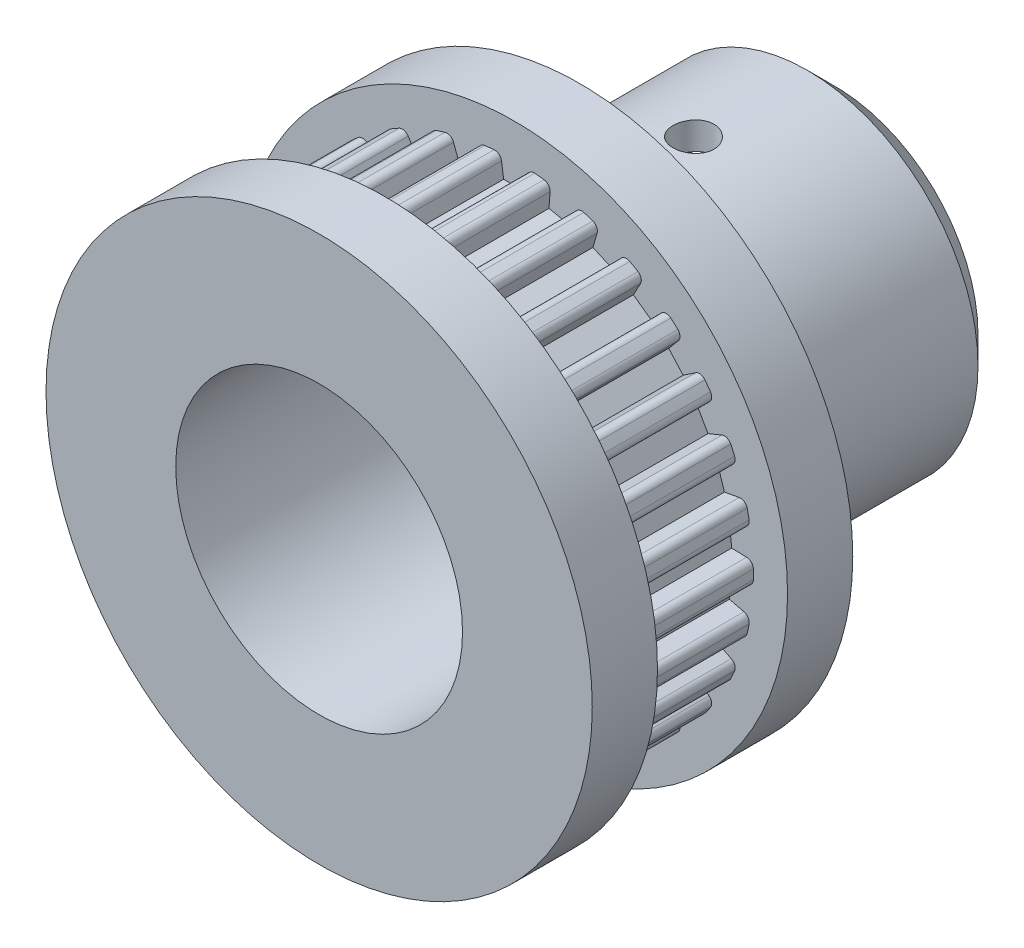
from build123d import *

# Parameters (mm, degrees)
SKETCH3_R                = 17.5
BOSS_EXTRUDE1_DEPTH      = 9.525
CUT_EXTRUDE1_DEPTH       = 9.525
FILLET1_R                = 0.508
FILLET2_R                = 0.508
SKETCH5_R                = 20
BOSS_EXTRUDE2_DEPTH      = 4.7752
CIRPATTERN1_COUNT        = 30
FILLET1_OF_CIRPATTERN1_R = 0.508
FILLET2_OF_CIRPATTERN1_R = 0.508
BOSS_EXTRUDE3_START      = 4.7752
SKETCH7_R                = 20
BOSS_EXTRUDE3_DEPTH      = 4.7752
SKETCH8_R                = 12.5
BOSS_EXTRUDE5_DEPTH      = 19.05
SKETCH12_R               = 10.5
CUT_EXTRUDE3_DEPTH       = 48.471529627
CHAMFER1_SIZE            = 2.38
CUT_EXTRUDE4_DEPTH       = 37.737955891
CUT_EXTRUDE4_DEPTH_BACK  = 1.27
SKETCH13_R               = 1.5


with BuildPart() as part:
    # Sketch3 → Boss-Extrude1 (new body)
    with BuildSketch(Plane.XY):
        with Locations(Location((0, 0, 0), (0, 0, 180))):
            Circle(SKETCH3_R)
    extrude(amount=BOSS_EXTRUDE1_DEPTH)

    # Sketch4 → Cut-Extrude1 (cut)
    with BuildSketch(Plane(origin=(0, 0, 0), x_dir=(-1, 0, 0), z_dir=(0, 0, -1))):
        Polygon((-1.5875, 21.740276586), (1.5875, 21.740276586), (0.79375, 15.9125), (-0.79375, 15.9125), align=None)
    cut_extrude1 = extrude(amount=-CUT_EXTRUDE1_DEPTH, mode=Mode.SUBTRACT)

    # Fillet1
    fillet1_edges = [part.edges().sort_by_distance(p)[0] for p in [
        (1.006027585, 17.471059169, 4.7625),
    ]]
    fillet(fillet1_edges, radius=FILLET1_R)

    # Fillet2
    fillet2_edges = [part.edges().sort_by_distance(p)[0] for p in [
        (-1.006027585, 17.471059169, 4.7625),
    ]]
    fillet(fillet2_edges, radius=FILLET2_R)

    # Sketch5 → Boss-Extrude2 (add)
    with BuildSketch(Plane.XY.offset(9.525)):
        Circle(SKETCH5_R)
    extrude(amount=BOSS_EXTRUDE2_DEPTH)

    # CirPattern1: Cut-Extrude1 ×30 about axis
    cirpattern1_axis = Axis((0, 0, 0), (0, 0, 1))
    for i in range(1, CIRPATTERN1_COUNT):
        add(cut_extrude1.rotate(cirpattern1_axis, i * 360 / CIRPATTERN1_COUNT), mode=Mode.SUBTRACT)

    # Fillet1 of CirPattern1
    fillet1_of_cirpattern1_edges = [part.edges().sort_by_distance(p)[0] for p in [
        (-2.648393984, 17.298439505, 4.7625),
        (-6.187068027, 16.369795027, 4.7625),
        (-9.455337508, 14.725711956, 4.7625),
        (-12.310363369, 12.43804461, 4.7625),
        (-14.627367279, 9.60677503, 4.7625),
        (-16.305085049, 6.355643284, 4.7625),
        (-17.270192362, 2.826739427, 4.7625),
        (-17.480509397, -0.825706506, 4.7625),
        (-16.92684429, -4.442065103, 4.7625),
        (-15.633394864, -7.864284139, 4.7625),
        (-13.656691065, -10.942796221, 4.7625),
        (-11.083124335, -13.5430556, 4.7625),
        (-8.025171888, -15.551418461, 4.7625),
        (-4.616480921, -16.880109713, 4.7625),
        (-1.006027585, -17.471059169, 4.7625),
        (2.648393984, -17.298439505, 4.7625),
        (6.187068027, -16.369795027, 4.7625),
        (9.455337508, -14.725711956, 4.7625),
        (12.310363369, -12.43804461, 4.7625),
        (14.627367279, -9.60677503, 4.7625),
        (16.305085049, -6.355643284, 4.7625),
        (17.270192362, -2.826739427, 4.7625),
        (17.480509397, 0.825706506, 4.7625),
        (16.92684429, 4.442065103, 4.7625),
        (15.633394864, 7.864284139, 4.7625),
        (13.656691065, 10.942796221, 4.7625),
        (11.083124335, 13.5430556, 4.7625),
        (8.025171888, 15.551418461, 4.7625),
        (4.616480921, 16.880109713, 4.7625),
    ]]
    fillet(fillet1_of_cirpattern1_edges, radius=FILLET1_OF_CIRPATTERN1_R)

    # Fillet2 of CirPattern1
    fillet2_of_cirpattern1_edges = [part.edges().sort_by_distance(p)[0] for p in [
        (-4.616480921, 16.880109713, 4.7625),
        (-8.025171888, 15.551418461, 4.7625),
        (-11.083124335, 13.5430556, 4.7625),
        (-13.656691065, 10.942796221, 4.7625),
        (-15.633394864, 7.864284139, 4.7625),
        (-16.92684429, 4.442065103, 4.7625),
        (-17.480509397, 0.825706506, 4.7625),
        (-17.270192362, -2.826739427, 4.7625),
        (-16.305085049, -6.355643284, 4.7625),
        (-14.627367279, -9.60677503, 4.7625),
        (-12.310363369, -12.43804461, 4.7625),
        (-9.455337508, -14.725711956, 4.7625),
        (-6.187068027, -16.369795027, 4.7625),
        (-2.648393984, -17.298439505, 4.7625),
        (1.006027585, -17.471059169, 4.7625),
        (4.616480921, -16.880109713, 4.7625),
        (8.025171888, -15.551418461, 4.7625),
        (11.083124335, -13.5430556, 4.7625),
        (13.656691065, -10.942796221, 4.7625),
        (15.633394864, -7.864284139, 4.7625),
        (16.92684429, -4.442065103, 4.7625),
        (17.480509397, -0.825706506, 4.7625),
        (17.270192362, 2.826739427, 4.7625),
        (16.305085049, 6.355643284, 4.7625),
        (14.627367279, 9.60677503, 4.7625),
        (12.310363369, 12.43804461, 4.7625),
        (9.455337508, 14.725711956, 4.7625),
        (6.187068027, 16.369795027, 4.7625),
        (2.648393984, 17.298439505, 4.7625),
    ]]
    fillet(fillet2_of_cirpattern1_edges, radius=FILLET2_OF_CIRPATTERN1_R)

    # Sketch7 → Boss-Extrude3 (add)
    with BuildSketch(Plane(origin=(0, 0, 0), x_dir=(-1, 0, 0), z_dir=(0, 0, -1)).offset(BOSS_EXTRUDE3_START)):
        with Locations(Location((0, 0, 0), (0, 0, 180))):
            Circle(SKETCH7_R)
    extrude(amount=-BOSS_EXTRUDE3_DEPTH)

    # Sketch8 → Boss-Extrude5 (add)
    with BuildSketch(Plane(origin=(0, 0, -4.7752), x_dir=(-1, 0, 0), z_dir=(0, 0, -1))):
        with Locations(Location((0, 0, 0), (0, 0, 180))):
            Circle(SKETCH8_R)
    extrude(amount=BOSS_EXTRUDE5_DEPTH)

    # Sketch12 → Cut-Extrude3 (cut, through all)
    with BuildSketch(Plane(origin=(0, 0, -23.8252), x_dir=(-1, 0, 0), z_dir=(0, 0, -1))):
        Circle(SKETCH12_R)
    extrude(amount=-CUT_EXTRUDE3_DEPTH, mode=Mode.SUBTRACT)

    # Chamfer1
    # the kernel refuses this chamfer: 2.38 mm, written as the material it takes off along each edge
    with BuildSketch(Plane(origin=(0, 0, -23.8252), x_dir=(1, 0, 0), z_dir=(0, 1, 0))) as chamfer1_piece_1:
        Polygon((12.5, -CHAMFER1_SIZE), (12.5 - CHAMFER1_SIZE, 0), (12.5, 0), align=None)
    revolve(axis=Axis((0, 0, -23.8252), (0, 0, -1)), mode=Mode.SUBTRACT)

    # Sketch13 → Cut-Extrude4 (cut, two sides: drawn at the far end of the back side and taken through both)
    with BuildSketch(Plane(origin=(0, 0, 0), x_dir=(1, 0, 0), z_dir=(0, 1, 0)).offset(-CUT_EXTRUDE4_DEPTH_BACK)):
        with Locations(Location((0, 13.1102, 0), (0, 0, 90))):
            Circle(SKETCH13_R)
    extrude(amount=CUT_EXTRUDE4_DEPTH + CUT_EXTRUDE4_DEPTH_BACK, mode=Mode.SUBTRACT)


solid = part.part
